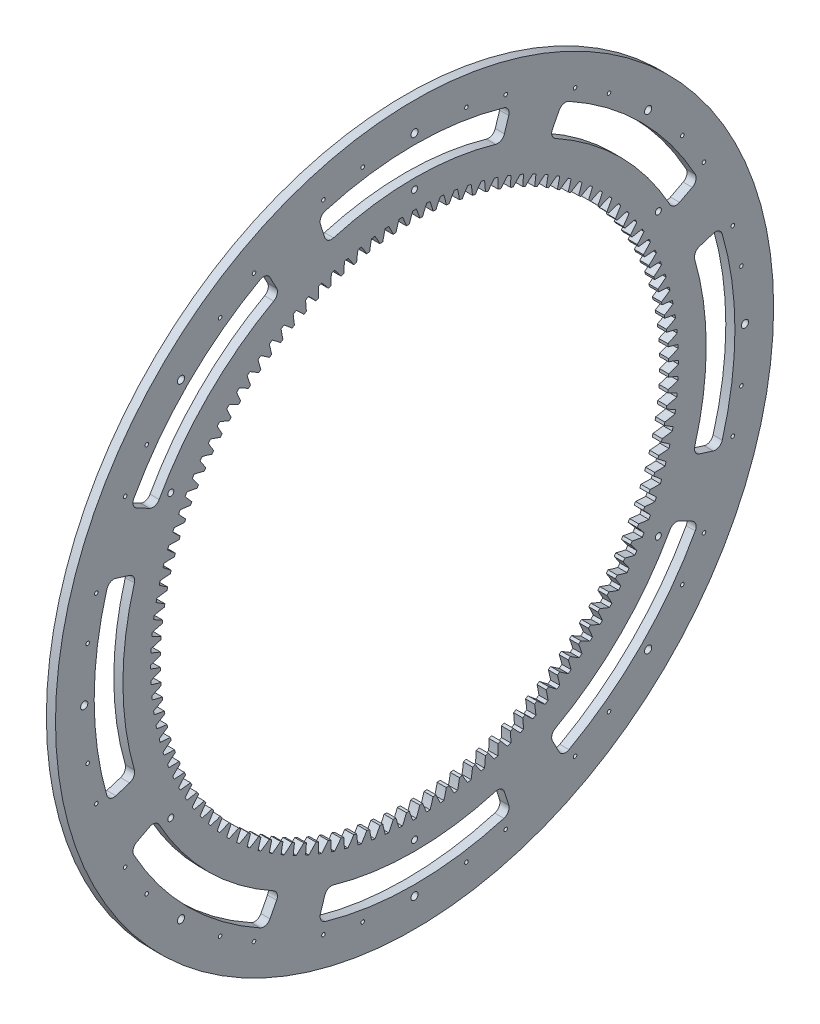
from build123d import *

# Parameters (mm, degrees)
BASPROSKE_W                 = 12.7
BASPROSKE_H                 = 73
TOOTHCUT_DEPTH              = 354.781415566
TEETHCUTS_COUNT             = 120
CUT_EXTRUDE1_REACH          = 569.113
TAP_DRILL_FOR_M6X1_0_TAP1_D = 5
TAP_DRILL_FOR_M5X0_8_TAP1_D = 4.2
TAP_DRILL_FOR_M3X0_5_TAP1_D = 2.5
CIRPATTERN1_COUNT           = 8
SKETCH7_R                   = 250
CUT_EXTRUDE2_DEPTH          = 6.35


with BuildPart() as part:
    # BasProSke → Base-Revolve (revolve)
    with BuildSketch(Plane(origin=(0, 0, 0), x_dir=(1, 0, 0), z_dir=(0, 1, 0))):
        with Locations((6.35, 213.5)):
            Rectangle(BASPROSKE_W, BASPROSKE_H)
    revolve(axis=Axis((-10, 0, 0), (1, 0, 0)))

    # TooCutSke → ToothCut (cut, through all)
    with BuildSketch(Plane(origin=(0, 0, 0), x_dir=(0, 0, -1), z_dir=(1, 0, 0))):
        with BuildLine():
            ThreePointArc((3.633217385, 176.937301824), (2.487024994, 180.366581894), (1.204013702, 183.747055356))
            ThreePointArc((1.204013702, 183.747055356), (0, 183.751), (-1.204013702, 183.747055356))
            ThreePointArc((-1.204013702, 183.747055356), (-2.487024994, 180.366581894), (-3.633217385, 176.937301824))
            ThreePointArc((-3.633217385, 176.937301824), (0, 176.9746), (3.633217385, 176.937301824))
        make_face()
    toothcut = extrude(amount=TOOTHCUT_DEPTH, mode=Mode.SUBTRACT)

    # TeethCuts: ToothCut ×120 about axis
    teethcuts_axis = Axis((-10, 0, 0), (1, 0, 0))
    for i in range(1, TEETHCUTS_COUNT):
        add(toothcut.rotate(teethcuts_axis, i * 360 / TEETHCUTS_COUNT), mode=Mode.SUBTRACT)

    # Sketch1 → Cut-Extrude1 (cut, up to next)
    with BuildSketch(Plane(origin=(12.7, 193.969714815, 102.628170151), x_dir=(0, 0, -1), z_dir=(1, 0, 0)), mode=Mode.PRIVATE) as cut_extrude1_sk1:
        with BuildLine():
            Line((37.073891438, 13.941894825), (40.081778275, 4.402096564))
            ThreePointArc((40.081778275, 4.402096564), (42.488491916, 1.49863511), (46.238860709, 1.102285662))
            ThreePointArc((46.238860709, 1.102285662), (102.628170151, 9.088994896), (159.017479593, 1.102285662))
            ThreePointArc((159.017479593, 1.102285662), (162.767848386, 1.49863511), (165.174562026, 4.402096564))
            Line((165.174562026, 4.402096564), (168.182448864, 13.941894825))
            ThreePointArc((168.182448864, 13.941894825), (167.82215573, 17.804865493), (164.80765604, 20.247230155))
            ThreePointArc((164.80765604, 20.247230155), (102.628170151, 29.088994896), (40.448684262, 20.247230155))
            ThreePointArc((40.448684262, 20.247230155), (37.434184572, 17.804865493), (37.073891438, 13.941894825))
        make_face()
    cut_extrude1_tool1 = extrude(cut_extrude1_sk1.sketch, amount=-CUT_EXTRUDE1_REACH, mode=Mode.PRIVATE) & part.part
    cut_extrude1 = cut_extrude1_tool1.solids().sort_by_distance((12.7, 209.966085, 0))[0]
    add(cut_extrude1, mode=Mode.SUBTRACT)

    # Tap Drill for M6x1.0 Tap1 (through all)
    with Locations(Plane(origin=(12.7, 230, 0), x_dir=(0, 0, 1), z_dir=(1, 0, 0))):
        with Locations((0, 0), (162.634559673, 67.365440327), (-162.634559673, 67.365440327), (230, 230), (-230, 230), (162.634559673, 392.634559673), (0, 460), (-162.634559673, 392.634559673)):
            Hole(TAP_DRILL_FOR_M6X1_0_TAP1_D / 2)

    # Tap Drill for M5x0.8 Tap1 (through all)
    with Locations(Plane(origin=(12.7, 196, 0), x_dir=(0, 0, 1), z_dir=(1, 0, 0))):
        with Locations((0, 0), (169.740979142, 98), (169.740979142, 294), (0, 392), (-169.740979142, 294), (-169.740979142, 98)):
            Hole(TAP_DRILL_FOR_M5X0_8_TAP1_D / 2)

    # Tap Drill for M3x0.5 Tap1 (through all)
    with Locations(Plane(origin=(12.7, 221.517927042, 63.449255305), x_dir=(0, 0, 1), z_dir=(1, 0, 0))):
        with Locations((0, 0), (-27.336288199, -6.060309191), (-99.562222411, -6.060309191), (-126.89851061, 0)):
            tap_drill_for_m3x0_5_tap1 = Hole(TAP_DRILL_FOR_M3X0_5_TAP1_D / 2)

    # CirPattern1: Cut-Extrude1, Tap Drill for M3x0.5 Tap1 ×8 about axis
    cirpattern1_axis = Axis((-10, 0, 0), (-1, 0, 0))
    add([cut_extrude1.rotate(cirpattern1_axis, i * 360 / CIRPATTERN1_COUNT) for i in range(1, CIRPATTERN1_COUNT)], mode=Mode.SUBTRACT)
    add([tap_drill_for_m3x0_5_tap1.rotate(cirpattern1_axis, i * 360 / CIRPATTERN1_COUNT) for i in range(1, CIRPATTERN1_COUNT)], mode=Mode.SUBTRACT)

    # Sketch7 → Cut-Extrude2 (cut)
    with BuildSketch(Plane(origin=(12.7, 0, 0), x_dir=(0, 0, -1), z_dir=(1, 0, 0))):
        Circle(SKETCH7_R)
    extrude(amount=-CUT_EXTRUDE2_DEPTH, mode=Mode.SUBTRACT)


solid = part.part
